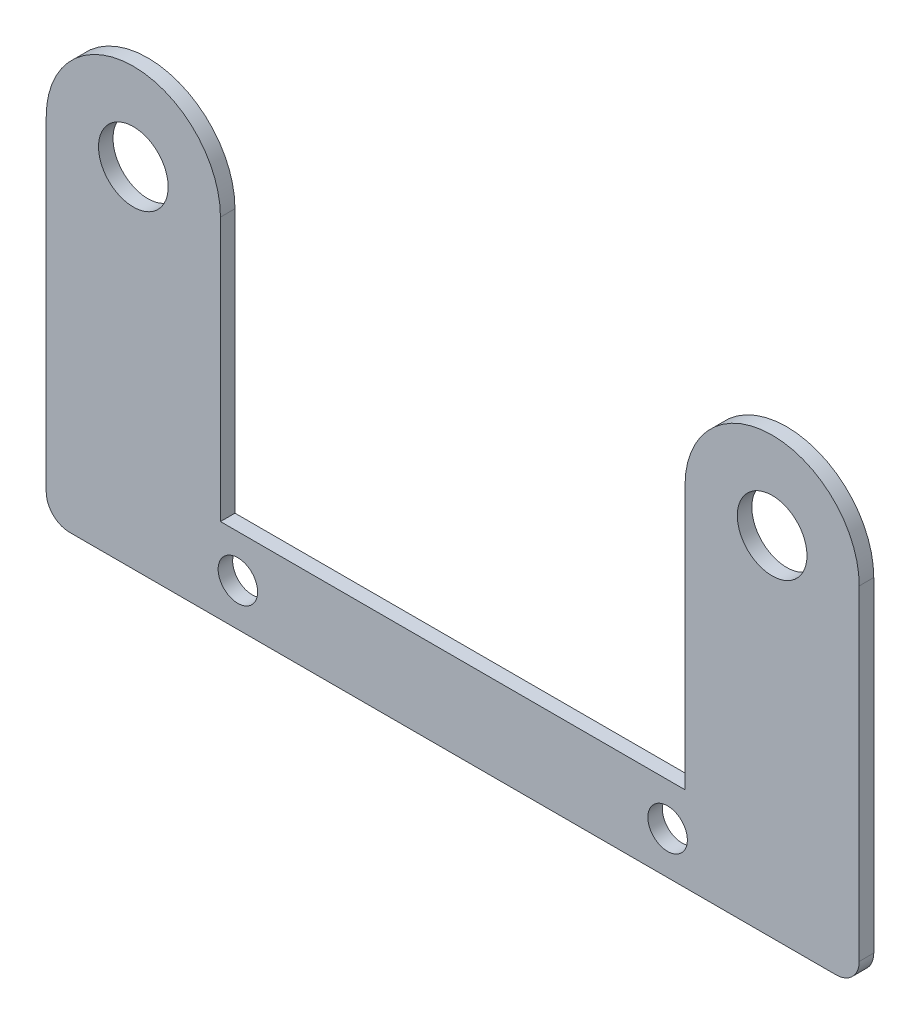
from build123d import *

# Parameters (mm, degrees)
SKETCH1_R           = 2.159
SKETCH1_R_2         = 3.81
BOSS_EXTRUDE1_DEPTH = 1.5875
FILLET1_R           = 2.54


with BuildPart() as part:
    # Sketch1 → Boss-Extrude1 (new body)
    with BuildSketch(Plane.XY):
        with BuildLine():
            Line((0, 38.1), (0, 0))
            Line((0, 0), (88.9, 0))
            Line((88.9, 0), (88.9, 38.1))
            ThreePointArc((88.9, 38.1), (79.375, 47.625), (69.85, 38.1))
            Line((69.85, 38.1), (69.85, 9.271))
            Line((69.85, 9.271), (19.05, 9.271))
            Line((19.05, 9.271), (19.05, 38.1))
            ThreePointArc((19.05, 38.1), (9.525, 47.625), (0, 38.1))
        make_face()
        with Locations((20.955, 4.6355)):
            Circle(SKETCH1_R, mode=Mode.SUBTRACT)
        with Locations((67.945, 4.6355)):
            Circle(SKETCH1_R, mode=Mode.SUBTRACT)
        with Locations((9.525, 38.1)):
            Circle(SKETCH1_R_2, mode=Mode.SUBTRACT)
        with Locations((79.375, 38.1)):
            Circle(SKETCH1_R_2, mode=Mode.SUBTRACT)
    extrude(amount=BOSS_EXTRUDE1_DEPTH)

    # Fillet1
    fillet1_edges = [part.edges().sort_by_distance(p)[0] for p in [
        (88.9, 0, 0.79375),
        (0, 0, 0.79375),
    ]]
    fillet(fillet1_edges, radius=FILLET1_R)


solid = part.part
